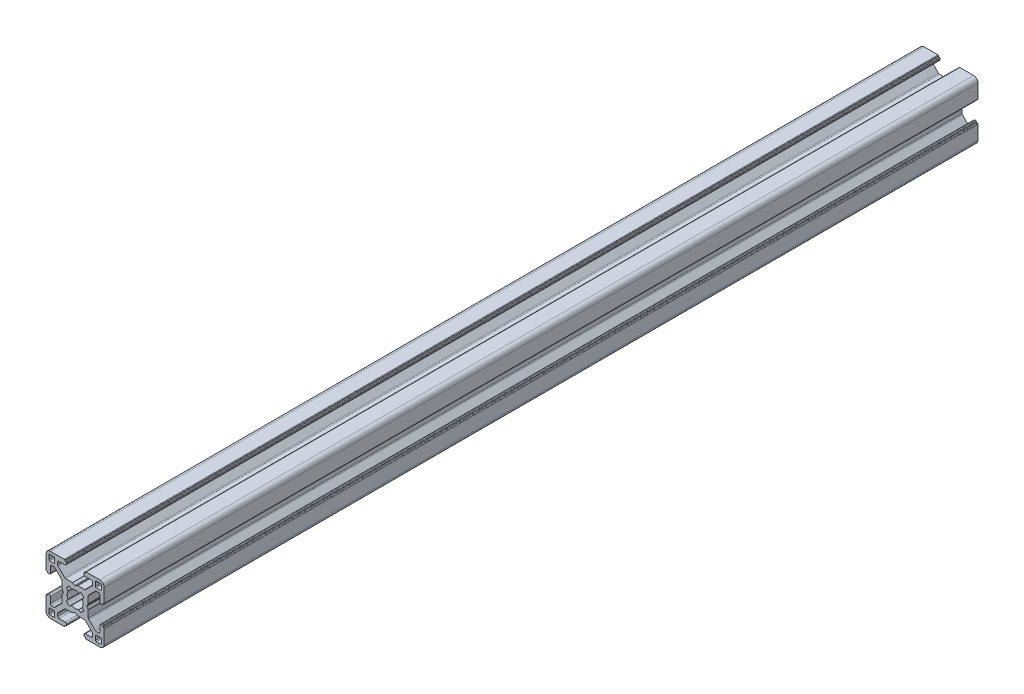
from build123d import *

# Parameters (mm, degrees)
ESTRUSIONE_ESTRUSIONE1_DEPTH = 300


with BuildPart() as part:
    # Schizzo1 → Estrusione-Estrusione1 (new body)
    with BuildSketch(Plane.XY.offset(100)):
        with BuildLine():
            Line((-9.299999732, 3), (-8.999999732, 3))
            ThreePointArc((-8.999999732, 3), (-8.646446341, 3.146446609), (-8.499999732, 3.5))
            Line((-8.499999732, 3.5), (-8.499999732, 5.499999605))
            ThreePointArc((-8.499999732, 5.499999605), (-8.353553123, 5.853552995), (-7.999999732, 5.999999605))
            Line((-7.999999732, 5.999999605), (-7.267766685, 5.999999605))
            ThreePointArc((-7.267766685, 5.999999605), (-7.076424969, 5.961939371), (-6.914213294, 5.853552995))
            Line((-6.914213294, 5.853552995), (-4.646446398, 3.585786099))
            ThreePointArc((-4.646446398, 3.585786099), (-4.538060023, 3.423574425), (-4.499999789, 3.232232708))
            Line((-4.499999789, 3.232232708), (-4.499999789, 0.953589302))
            ThreePointArc((-4.499999789, 0.953589302), (-4.493184953, 0.90182549), (-4.473204867, 0.853589297))
            Line((-4.473204867, 0.853589297), (-4.038119841, 0.099999969))
            ThreePointArc((-4.038119841, 0.099999969), (-4.011324929, 0), (-4.038119841, -0.099999969))
            Line((-4.038119841, -0.099999969), (-4.473204867, -0.853589297))
            ThreePointArc((-4.473204867, -0.853589297), (-4.493184953, -0.90182549), (-4.499999789, -0.953589302))
            Line((-4.499999789, -0.953589302), (-4.499999789, -3.232232708))
            ThreePointArc((-4.499999789, -3.232232708), (-4.538060023, -3.423574425), (-4.646446398, -3.585786099))
            Line((-4.646446398, -3.585786099), (-6.914213294, -5.853552995))
            ThreePointArc((-6.914213294, -5.853552995), (-7.076424969, -5.961939371), (-7.267766685, -5.999999605))
            Line((-7.267766685, -5.999999605), (-7.999999732, -5.999999605))
            ThreePointArc((-7.999999732, -5.999999605), (-8.353553123, -5.853552995), (-8.499999732, -5.499999605))
            Line((-8.499999732, -5.499999605), (-8.499999732, -3.5))
            ThreePointArc((-8.499999732, -3.5), (-8.646446341, -3.146446609), (-8.999999732, -3))
            Line((-8.999999732, -3), (-9.299999732, -3))
            ThreePointArc((-9.299999732, -3), (-9.441421088, -3.058578644), (-9.499999732, -3.2))
            Line((-9.499999732, -3.2), (-9.499999732, -3.349999605))
            ThreePointArc((-9.499999732, -3.349999605), (-9.558578376, -3.491420961), (-9.699999732, -3.549999605))
            Line((-9.699999732, -3.549999605), (-9.8, -3.549999605))
            ThreePointArc((-9.8, -3.549999605), (-9.941421356, -3.608578248), (-10, -3.749999605))
            Line((-10, -3.749999605), (-10, -8.5))
            ThreePointArc((-10, -8.5), (-9.560660172, -9.560660172), (-8.5, -10))
            Line((-8.5, -10), (-3.750000228, -10))
            ThreePointArc((-3.750000228, -10), (-3.608578871, -9.941421356), (-3.550000228, -9.8))
            Line((-3.550000228, -9.8), (-3.550000228, -9.7))
            ThreePointArc((-3.550000228, -9.7), (-3.491421584, -9.558578644), (-3.350000228, -9.5))
            Line((-3.350000228, -9.5), (-3.2, -9.5))
            ThreePointArc((-3.2, -9.5), (-3.058578644, -9.441421356), (-3, -9.3))
            Line((-3, -9.3), (-3, -8.999999673))
            ThreePointArc((-3, -8.999999673), (-3.146446609, -8.646446283), (-3.5, -8.499999673))
            Line((-3.5, -8.499999673), (-5.500000686, -8.499999673))
            ThreePointArc((-5.500000686, -8.499999673), (-5.853554077, -8.353553064), (-6.000000686, -7.999999673))
            Line((-6.000000686, -7.999999673), (-6.000000686, -7.267766626))
            ThreePointArc((-6.000000686, -7.267766626), (-5.961940448, -7.076424899), (-5.853554059, -6.914213219))
            Line((-5.853554059, -6.914213219), (-3.585787212, -4.646446592))
            ThreePointArc((-3.585787212, -4.646446592), (-3.423575544, -4.538060229), (-3.232233839, -4.5))
            Line((-3.232233839, -4.5), (-0.953590312, -4.5))
            ThreePointArc((-0.953590312, -4.5), (-0.901826505, -4.493185166), (-0.853590316, -4.473205083))
            Line((-0.853590316, -4.473205083), (-0.100000045, -4.038119562))
            ThreePointArc((-0.100000045, -4.038119562), (0, -4.011324632), (0.100000045, -4.038119562))
            Line((0.100000045, -4.038119562), (0.853590316, -4.473205083))
            ThreePointArc((0.853590316, -4.473205083), (0.901826505, -4.493185166), (0.953590312, -4.5))
            Line((0.953590312, -4.5), (3.23223292, -4.5))
            ThreePointArc((3.23223292, -4.5), (3.423574636, -4.538060234), (3.58578631, -4.646446609))
            Line((3.58578631, -4.646446609), (5.853554077, -6.914214376))
            ThreePointArc((5.853554077, -6.914214376), (5.961940452, -7.07642605), (6.000000686, -7.267767766))
            Line((6.000000686, -7.267767766), (6.000000686, -7.999999673))
            ThreePointArc((6.000000686, -7.999999673), (5.853554077, -8.353553064), (5.500000686, -8.499999673))
            Line((5.500000686, -8.499999673), (3.5, -8.499999673))
            ThreePointArc((3.5, -8.499999673), (3.146446609, -8.646446283), (3, -8.999999673))
            Line((3, -8.999999673), (3, -9.3))
            ThreePointArc((3, -9.3), (3.058578644, -9.441421356), (3.2, -9.5))
            Line((3.2, -9.5), (3.350000228, -9.5))
            ThreePointArc((3.350000228, -9.5), (3.491421584, -9.558578644), (3.550000228, -9.7))
            Line((3.550000228, -9.7), (3.550000228, -9.8))
            ThreePointArc((3.550000228, -9.8), (3.608578871, -9.941421356), (3.750000228, -10))
            Line((3.750000228, -10), (8.5, -10))
            ThreePointArc((8.5, -10), (9.560660172, -9.560660172), (10, -8.5))
            Line((10, -8.5), (10, -3.749999605))
            ThreePointArc((10, -3.749999605), (9.941421356, -3.608578248), (9.8, -3.549999605))
            Line((9.8, -3.549999605), (9.699999732, -3.549999605))
            ThreePointArc((9.699999732, -3.549999605), (9.558578376, -3.491420961), (9.499999732, -3.349999605))
            Line((9.499999732, -3.349999605), (9.499999732, -3.2))
            ThreePointArc((9.499999732, -3.2), (9.441421088, -3.058578644), (9.299999732, -3))
            Line((9.299999732, -3), (8.999999732, -3))
            ThreePointArc((8.999999732, -3), (8.646446341, -3.146446609), (8.499999732, -3.5))
            Line((8.499999732, -3.5), (8.499999732, -5.499999605))
            ThreePointArc((8.499999732, -5.499999605), (8.353553123, -5.853552995), (7.999999732, -5.999999605))
            Line((7.999999732, -5.999999605), (7.267766789, -5.999999605))
            ThreePointArc((7.267766789, -5.999999605), (7.076425084, -5.961939376), (6.914213416, -5.853553012))
            Line((6.914213416, -5.853553012), (4.646446415, -3.585786233))
            ThreePointArc((4.646446415, -3.585786233), (4.538060027, -3.423574553), (4.499999789, -3.232232825))
            Line((4.499999789, -3.232232825), (4.499999789, -0.953589302))
            ThreePointArc((4.499999789, -0.953589302), (4.493184953, -0.90182549), (4.473204867, -0.853589297))
            Line((4.473204867, -0.853589297), (4.038119841, -0.099999969))
            ThreePointArc((4.038119841, -0.099999969), (4.011324929, 0), (4.038119841, 0.099999969))
            Line((4.038119841, 0.099999969), (4.473204867, 0.853589297))
            ThreePointArc((4.473204867, 0.853589297), (4.493184953, 0.90182549), (4.499999789, 0.953589302))
            Line((4.499999789, 0.953589302), (4.499999789, 3.232232825))
            ThreePointArc((4.499999789, 3.232232825), (4.538060027, 3.423574553), (4.646446415, 3.585786233))
            Line((4.646446415, 3.585786233), (6.914213416, 5.853553012))
            ThreePointArc((6.914213416, 5.853553012), (7.076425084, 5.961939376), (7.267766789, 5.999999605))
            Line((7.267766789, 5.999999605), (7.999999732, 5.999999605))
            ThreePointArc((7.999999732, 5.999999605), (8.353553123, 5.853552995), (8.499999732, 5.499999605))
            Line((8.499999732, 5.499999605), (8.499999732, 3.5))
            ThreePointArc((8.499999732, 3.5), (8.646446341, 3.146446609), (8.999999732, 3))
            Line((8.999999732, 3), (9.299999732, 3))
            ThreePointArc((9.299999732, 3), (9.441421088, 3.058578644), (9.499999732, 3.2))
            Line((9.499999732, 3.2), (9.499999732, 3.349999605))
            ThreePointArc((9.499999732, 3.349999605), (9.558578376, 3.491420961), (9.699999732, 3.549999605))
            Line((9.699999732, 3.549999605), (9.8, 3.549999605))
            ThreePointArc((9.8, 3.549999605), (9.941421356, 3.608578248), (10, 3.749999605))
            Line((10, 3.749999605), (10, 8.5))
            ThreePointArc((10, 8.5), (9.560660172, 9.560660172), (8.5, 10))
            Line((8.5, 10), (3.750000228, 10))
            ThreePointArc((3.750000228, 10), (3.608578871, 9.941421356), (3.550000228, 9.8))
            Line((3.550000228, 9.8), (3.550000228, 9.7))
            ThreePointArc((3.550000228, 9.7), (3.491421584, 9.558578644), (3.350000228, 9.5))
            Line((3.350000228, 9.5), (3.2, 9.5))
            ThreePointArc((3.2, 9.5), (3.058578644, 9.441421356), (3, 9.3))
            Line((3, 9.3), (3, 8.999999673))
            ThreePointArc((3, 8.999999673), (3.146446609, 8.646446283), (3.5, 8.499999673))
            Line((3.5, 8.499999673), (5.500000686, 8.499999673))
            ThreePointArc((5.500000686, 8.499999673), (5.853554077, 8.353553064), (6.000000686, 7.999999673))
            Line((6.000000686, 7.999999673), (6.000000686, 7.267767766))
            ThreePointArc((6.000000686, 7.267767766), (5.961940452, 7.07642605), (5.853554077, 6.914214376))
            Line((5.853554077, 6.914214376), (3.58578631, 4.646446609))
            ThreePointArc((3.58578631, 4.646446609), (3.423574636, 4.538060234), (3.23223292, 4.5))
            Line((3.23223292, 4.5), (0.953590312, 4.5))
            ThreePointArc((0.953590312, 4.5), (0.901826505, 4.493185166), (0.853590316, 4.473205083))
            Line((0.853590316, 4.473205083), (0.100000045, 4.038119562))
            ThreePointArc((0.100000045, 4.038119562), (0, 4.011324632), (-0.100000045, 4.038119562))
            Line((-0.100000045, 4.038119562), (-0.853590316, 4.473205083))
            ThreePointArc((-0.853590316, 4.473205083), (-0.901826505, 4.493185166), (-0.953590312, 4.5))
            Line((-0.953590312, 4.5), (-3.232233839, 4.5))
            ThreePointArc((-3.232233839, 4.5), (-3.423575544, 4.538060229), (-3.585787212, 4.646446592))
            Line((-3.585787212, 4.646446592), (-5.853554059, 6.914213219))
            ThreePointArc((-5.853554059, 6.914213219), (-5.961940448, 7.076424899), (-6.000000686, 7.267766626))
            Line((-6.000000686, 7.267766626), (-6.000000686, 7.999999673))
            ThreePointArc((-6.000000686, 7.999999673), (-5.853554077, 8.353553064), (-5.500000686, 8.499999673))
            Line((-5.500000686, 8.499999673), (-3.5, 8.499999673))
            ThreePointArc((-3.5, 8.499999673), (-3.146446609, 8.646446283), (-3, 8.999999673))
            Line((-3, 8.999999673), (-3, 9.3))
            ThreePointArc((-3, 9.3), (-3.058578644, 9.441421356), (-3.2, 9.5))
            Line((-3.2, 9.5), (-3.350000228, 9.5))
            ThreePointArc((-3.350000228, 9.5), (-3.491421584, 9.558578644), (-3.550000228, 9.7))
            Line((-3.550000228, 9.7), (-3.550000228, 9.8))
            ThreePointArc((-3.550000228, 9.8), (-3.608578871, 9.941421356), (-3.750000228, 10))
            Line((-3.750000228, 10), (-8.5, 10))
            ThreePointArc((-8.5, 10), (-9.560660172, 9.560660172), (-10, 8.5))
            Line((-10, 8.5), (-10, 3.749999605))
            ThreePointArc((-10, 3.749999605), (-9.941421356, 3.608578248), (-9.8, 3.549999605))
            Line((-9.8, 3.549999605), (-9.699999732, 3.549999605))
            ThreePointArc((-9.699999732, 3.549999605), (-9.558578376, 3.491420961), (-9.499999732, 3.349999605))
            Line((-9.499999732, 3.349999605), (-9.499999732, 3.2))
            ThreePointArc((-9.499999732, 3.2), (-9.441421088, 3.058578644), (-9.299999732, 3))
        make_face()
        with BuildLine():
            Line((-1.91389502, 2.989640962), (-1.258185436, 2.445295362))
            ThreePointArc((-1.258185436, 2.445295362), (0, 2.75), (1.258185436, 2.445295362))
            Line((1.258185436, 2.445295362), (1.91389502, 2.989640962))
            ThreePointArc((1.91389502, 2.989640962), (2.511737261, 2.508410485), (2.992174953, 1.909930962))
            Line((2.992174953, 1.909930962), (2.445295423, 1.258185317))
            ThreePointArc((2.445295423, 1.258185317), (2.75, 0), (2.445295423, -1.258185317))
            Line((2.445295423, -1.258185317), (2.992174953, -1.909930962))
            ThreePointArc((2.992174953, -1.909930962), (2.511737261, -2.508410485), (1.91389502, -2.989640962))
            Line((1.91389502, -2.989640962), (1.258185436, -2.445295362))
            ThreePointArc((1.258185436, -2.445295362), (0, -2.75), (-1.258185436, -2.445295362))
            Line((-1.258185436, -2.445295362), (-1.91389502, -2.989640962))
            ThreePointArc((-1.91389502, -2.989640962), (-2.511737261, -2.508410485), (-2.992174953, -1.909930962))
            Line((-2.992174953, -1.909930962), (-2.445295423, -1.258185317))
            ThreePointArc((-2.445295423, -1.258185317), (-2.75, 0), (-2.445295423, 1.258185317))
            Line((-2.445295423, 1.258185317), (-2.992174953, 1.909930962))
            ThreePointArc((-2.992174953, 1.909930962), (-2.511737261, 2.508410485), (-1.91389502, 2.989640962))
        make_face(mode=Mode.SUBTRACT)
        with BuildLine():
            Line((8.699999314, 7.000000686), (7.3, 7.000000686))
            ThreePointArc((7.3, 7.000000686), (7.087867966, 7.087868652), (7, 7.300000686))
            Line((7, 7.300000686), (7, 8.7))
            ThreePointArc((7, 8.7), (7.087867966, 8.912132034), (7.3, 9))
            Line((7.3, 9), (8.699999314, 9))
            ThreePointArc((8.699999314, 9), (8.912131348, 8.912132034), (8.999999314, 8.7))
            Line((8.999999314, 8.7), (8.999999314, 7.300000686))
            ThreePointArc((8.999999314, 7.300000686), (8.912131348, 7.087868652), (8.699999314, 7.000000686))
        make_face(mode=Mode.SUBTRACT)
        with BuildLine():
            Line((-7.300000686, 7.000000686), (-8.7, 7.000000686))
            ThreePointArc((-8.7, 7.000000686), (-8.912132034, 7.087868652), (-9, 7.300000686))
            Line((-9, 7.300000686), (-9, 8.7))
            ThreePointArc((-9, 8.7), (-8.912132034, 8.912132034), (-8.7, 9))
            Line((-8.7, 9), (-7.300000686, 9))
            ThreePointArc((-7.300000686, 9), (-7.087868652, 8.912132034), (-7.000000686, 8.7))
            Line((-7.000000686, 8.7), (-7.000000686, 7.300000686))
            ThreePointArc((-7.000000686, 7.300000686), (-7.087868652, 7.087868652), (-7.300000686, 7.000000686))
        make_face(mode=Mode.SUBTRACT)
        with BuildLine():
            Line((8.699999314, -8.999999314), (7.3, -8.999999314))
            ThreePointArc((7.3, -8.999999314), (7.087867966, -8.912131348), (7, -8.699999314))
            Line((7, -8.699999314), (7, -7.3))
            ThreePointArc((7, -7.3), (7.087867966, -7.087867966), (7.3, -7))
            Line((7.3, -7), (8.699999314, -7))
            ThreePointArc((8.699999314, -7), (8.912131348, -7.087867966), (8.999999314, -7.3))
            Line((8.999999314, -7.3), (8.999999314, -8.699999314))
            ThreePointArc((8.999999314, -8.699999314), (8.912131348, -8.912131348), (8.699999314, -8.999999314))
        make_face(mode=Mode.SUBTRACT)
        with BuildLine():
            Line((-7.300000686, -8.999999314), (-8.7, -8.999999314))
            ThreePointArc((-8.7, -8.999999314), (-8.912132034, -8.912131348), (-9, -8.699999314))
            Line((-9, -8.699999314), (-9, -7.3))
            ThreePointArc((-9, -7.3), (-8.912132034, -7.087867966), (-8.7, -7))
            Line((-8.7, -7), (-7.300000686, -7))
            ThreePointArc((-7.300000686, -7), (-7.087868652, -7.087867966), (-7.000000686, -7.3))
            Line((-7.000000686, -7.3), (-7.000000686, -8.699999314))
            ThreePointArc((-7.000000686, -8.699999314), (-7.087868652, -8.912131348), (-7.300000686, -8.999999314))
        make_face(mode=Mode.SUBTRACT)
    extrude(amount=-ESTRUSIONE_ESTRUSIONE1_DEPTH)


solid = part.part
